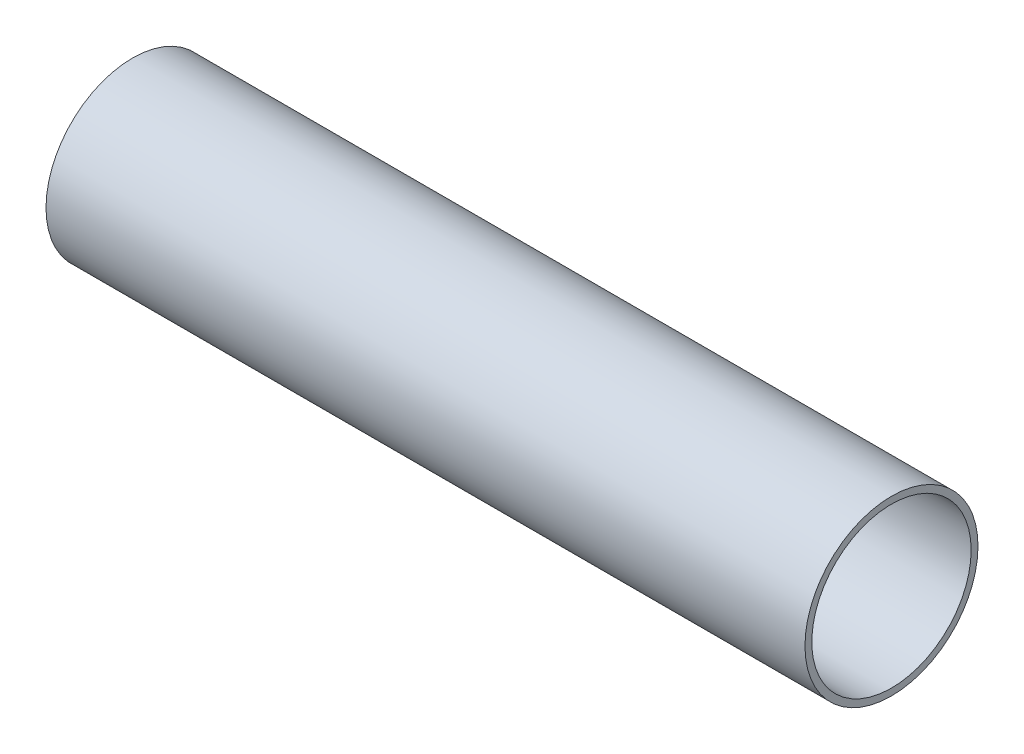
from build123d import *

# Parameters (mm, degrees)
CROQUIS1_R              = 57
CROQUIS1_R_2            = 52.5
SALIENTE_EXTRUIR1_DEPTH = 500


with BuildPart() as part:
    # Croquis1 → Saliente-Extruir1 (new body)
    with BuildSketch(Plane(origin=(0, 0, 0), x_dir=(0, 0, -1), z_dir=(1, 0, 0))):
        Circle(CROQUIS1_R)
        Circle(CROQUIS1_R_2, mode=Mode.SUBTRACT)
    extrude(amount=SALIENTE_EXTRUIR1_DEPTH)


solid = part.part
